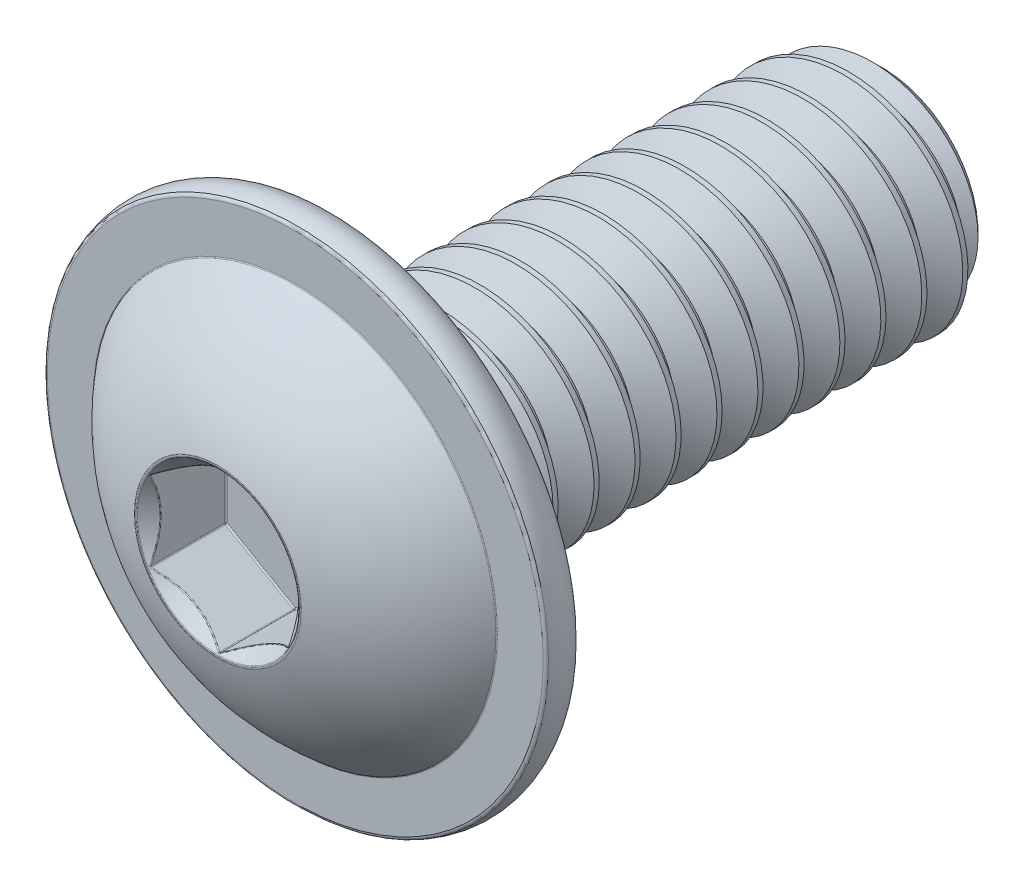
from build123d import *

# Parameters (mm, degrees)
CUT_EXTRUDE1_DEPTH = 2.667
SKETCH5_R          = 2.797255657
CUT_EXTRUDE2_DEPTH = 2.667
CUT_EXTRUDE2_TAPER = 45
FILLET3_R          = 0.047625
FILLET4_R          = 0.11938
CUT_SWEEP1_PITCH   = 1.411111111
CUT_SWEEP1_TO      = 18.542


with BuildPart() as part:
    # Sketch3 → Revolve1 (revolve)
    with BuildSketch(Plane(origin=(0, 0, 0), x_dir=(0, 0, -1), z_dir=(1, 0, 0)), mode=Mode.PRIVATE) as revolve1_sk:
        with BuildLine():
            Line((-11.4554, 0), (-11.4554, 2.868693157))
            ThreePointArc((-11.4554, 2.868693157), (-10.4455364, 5.116598156), (-8.7884, 6.94055))
            Line((-8.7884, 6.94055), (-8.7884, 8.61187))
            ThreePointArc((-8.7884, 8.61187), (-8.174148331, 8.725696695), (-7.5946, 8.49249))
            Line((-7.5946, 8.49249), (-7.5946, 4.4831))
            ThreePointArc((-7.5946, 4.4831), (-7.445810245, 4.123889755), (-7.0866, 3.9751))
            Line((-7.0866, 3.9751), (10.749844444, 3.9751))
            Line((10.749844444, 3.9751), (11.4554, 3.269544444))
            Line((11.4554, 3.269544444), (11.4554, 0))
            Line((11.4554, 0), (-11.4554, 0))
        make_face()
    revolve(revolve1_sk.sketch.rotate(Axis((0, 0, -11.4554), (0, 0, 1)), 90), axis=Axis((0, 0, -11.4554), (0, 0, 1)))

    # Sketch4 → Cut-Extrude1 (cut)
    with BuildSketch(Plane.XY.offset(11.4554)):
        Polygon((0, 2.749630657), (-2.38125, 1.374815329), (-2.38125, -1.374815329), (0, -2.749630657), (2.38125, -1.374815329), (2.38125, 1.374815329), align=None)
    extrude(amount=-CUT_EXTRUDE1_DEPTH, mode=Mode.SUBTRACT)

    # Sketch5 → Cut-Extrude2 (cut)
    with BuildSketch(Plane.XY.offset(11.4554)):
        Circle(SKETCH5_R)
    extrude(amount=-CUT_EXTRUDE2_DEPTH, taper=CUT_EXTRUDE2_TAPER, mode=Mode.SUBTRACT)

    # Fillet3
    fillet3_edges = [part.edges().sort_by_distance(p)[0] for p in [
        (0, 2.749630657, 10.0980875),
        (2.38125, 1.374815329, 10.0980875),
        (2.38125, -1.374815329, 10.0980875),
        (0, -2.749630657, 10.0980875),
        (-2.38125, -1.374815329, 10.0980875),
        (-2.38125, 1.374815329, 10.0980875),
        (1.190625, 2.062222993, 8.7884),
        (2.38125, 0, 8.7884),
        (1.190625, -2.062222993, 8.7884),
        (-1.190625, -2.062222993, 8.7884),
        (-2.38125, 0, 8.7884),
        (-1.190625, 2.062222993, 8.7884),
        (-2.797255657, 0, 11.4554),
        (2.38125, -0.70844148, 11.142543847),
        (1.190625, 2.062222993, 11.039394343),
        (-1.190625, 2.062222993, 11.039394343),
        (-2.38125, 0, 11.039394343),
        (-1.190625, -2.062222993, 11.039394343),
        (1.190625, -2.062222993, 11.039394343),
        (2.868693157, 0, 11.4554),
        (6.94055, 0, 8.7884),
    ]]
    fillet(fillet3_edges, radius=FILLET3_R)

    # Fillet4
    fillet4_edges = [part.edges().sort_by_distance(p)[0] for p in [
        (8.61187, 0, 8.7884),
        (8.49249, 0, 7.5946),
    ]]
    fillet(fillet4_edges, radius=FILLET4_R)


with BuildPart() as body_2:
    # Split1: the piece on the far side of the plane
    add(part.part)
    split(bisect_by=Plane.XY.offset(7.0866), keep=Keep.BOTTOM)

    # Cut-Sweep1: arcs per turn and ends read off the stored shape
    # Cut-Sweep1: the profile of Sketch7 screwed along a right-hand helix through 15 turns, 8 arcs to a turn; built about Z, then put on its axis
    cut_sweep1_z = Axis((0, 0, 0), (0, 0, 1))
    cut_sweep1_corners = [(4.051478629, 0, 0.044097222), (4.051478629, 0, -1.278819444), (3.058556448, 0, -0.705555556), (3.058556448, 0, -0.529166667)]
    with BuildLine(mode=Mode.PRIVATE) as cut_sweep1_profile:
        Line(cut_sweep1_corners[0], cut_sweep1_corners[1])
        Line(cut_sweep1_corners[1], cut_sweep1_corners[2])
        Line(cut_sweep1_corners[2], cut_sweep1_corners[3])
        Line(cut_sweep1_corners[3], cut_sweep1_corners[0])
    cut_sweep1_cap = Face(cut_sweep1_profile.wire())
    cut_sweep1_turn_angles = [0, 22.5, 45, 67.5, 90, 112.5, 135, 157.5, 180, 202.5, 225, 247.5, 270, 292.5, 315, 337.5, 360]
    cut_sweep1_turn_weights = [1, 0.9238795325112867, 1, 0.9238795325112867, 1, 0.9238795325112867, 1, 0.9238795325112867, 1, 0.9238795325112867, 1, 0.9238795325112867, 1, 0.9238795325112867, 1, 0.9238795325112867, 1]
    cut_sweep1_turn_rails = [Edge.make_bspline([Vector(p[0], p[1], 0).rotate(cut_sweep1_z, cut_sweep1_turn_angles[k]) / cut_sweep1_turn_weights[k] + Vector(0, 0, p[2] + CUT_SWEEP1_PITCH * cut_sweep1_turn_angles[k] / 360) for k in range(17)], [0, 0, 0, 1, 1, 2, 2, 3, 3, 4, 4, 5, 5, 6, 6, 7, 7, 8, 8, 8], 2, cut_sweep1_turn_weights) for p in cut_sweep1_corners]
    cut_sweep1_turn_sides = [Face.make_surface_from_curves(cut_sweep1_turn_rails[p[0]], cut_sweep1_turn_rails[p[1]]) for p in [(0, 1), (1, 2), (2, 3), (3, 0)]]
    cut_sweep1 = Plane(origin=(0, 0, -11.4554), x_dir=(0, 1, 0), z_dir=(0, 0, 1)) * split(Solid(Shell([*[p.moved(Location((0, 0, CUT_SWEEP1_PITCH * i))) for i in range(15) for p in cut_sweep1_turn_sides], cut_sweep1_cap, cut_sweep1_cap.rotate(cut_sweep1_z, 5400).moved(Location((0, 0, CUT_SWEEP1_PITCH * 5400 / 360)))])), bisect_by=Plane.XY.offset(CUT_SWEEP1_TO), keep=Keep.BOTTOM, mode=Mode.PRIVATE)
    add(cut_sweep1, mode=Mode.SUBTRACT)


with BuildPart() as part_1:
    add(part.part)

    # Split1
    split(bisect_by=Plane.XY.offset(7.0866), keep=Keep.TOP)

    add(body_2.part)  # Boss-Extrude1 merges body 2
    # Boss-Extrude1 cone 1 section (through the dimple's axis) → Boss-Extrude1 (revolve)
    with BuildSketch(Plane(origin=(0, 0, 7.0866), x_dir=(0, -1, 0), z_dir=(1, 0, 0))):
        Polygon((0, 0), (3.9751, 0), (0, 3.9751), align=None)
    revolve(axis=Axis((0, 0, 7.0866), (0, 0, -1)))


solid = part_1.part
